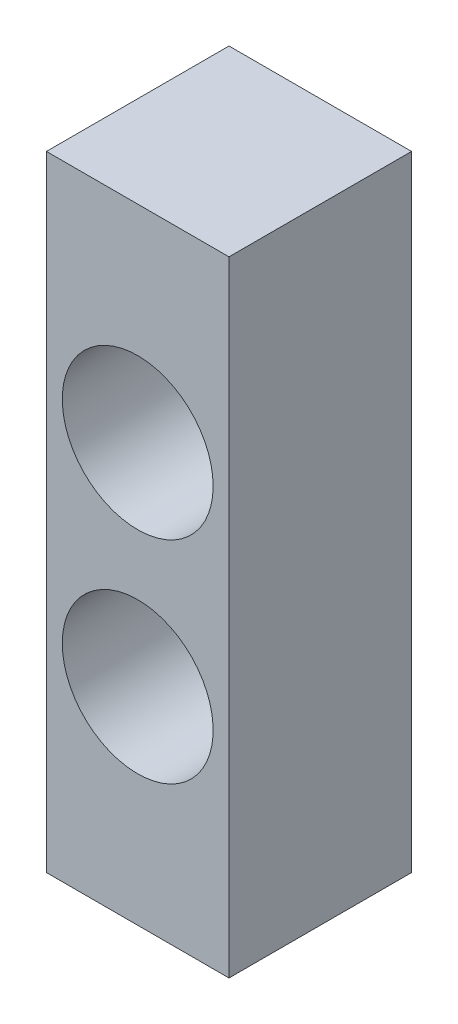
from build123d import *

# Parameters (mm, degrees)
SKETCH1_W           = 9.652
SKETCH1_H           = 9.652
BOSS_EXTRUDE1_DEPTH = 33.02
SKETCH2_R           = 3.9878
CUT_EXTRUDE1_DEPTH  = 35.738620871


with BuildPart() as part:
    # Sketch1 → Boss-Extrude1 (new body)
    with BuildSketch(Plane(origin=(0, 0, 0), x_dir=(1, 0, 0), z_dir=(0, 1, 0))):
        Rectangle(SKETCH1_W, SKETCH1_H)
    extrude(amount=BOSS_EXTRUDE1_DEPTH)

    # Sketch2 → Cut-Extrude1 (cut, through all)
    with BuildSketch(Plane.XY.offset(4.826)):
        with Locations((0, 22.098)):
            Circle(SKETCH2_R)
        with Locations((0, 10.922)):
            Circle(SKETCH2_R)
    extrude(amount=-CUT_EXTRUDE1_DEPTH, mode=Mode.SUBTRACT)


solid = part.part
